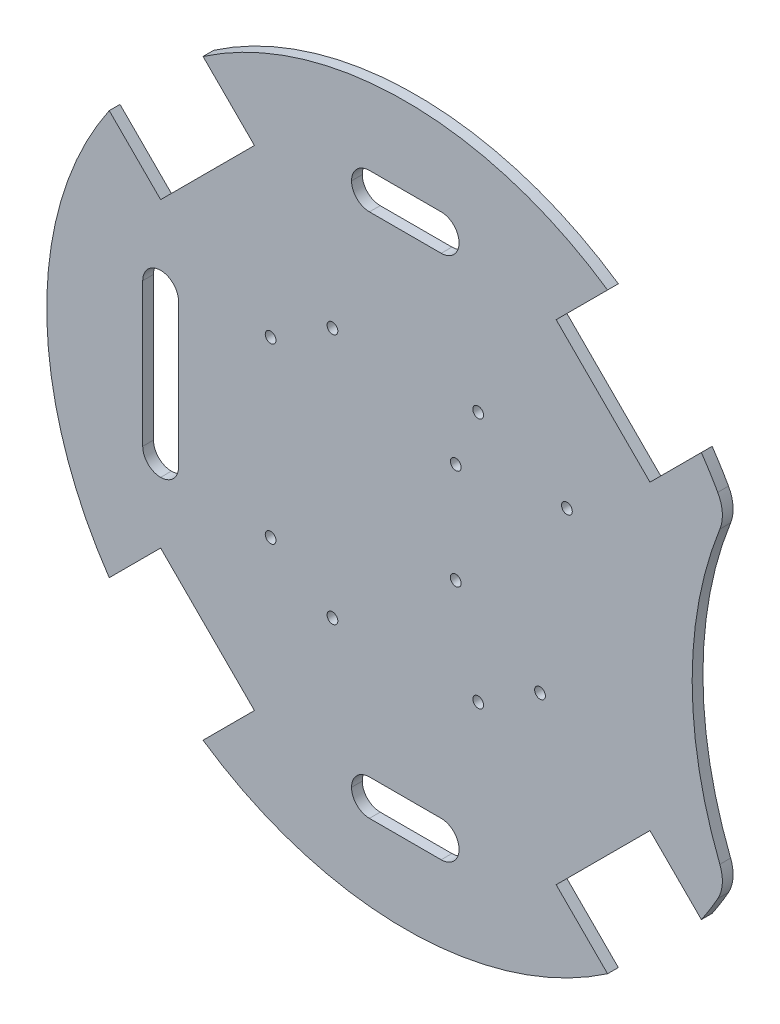
from build123d import *

# Parameters (mm, degrees)
CROQUIS1_R              = 100
SALIENTE_EXTRUIR1_DEPTH = 3
CROQUIS3_R              = 110
CORTAR_EXTRUIR1_DEPTH   = 3
REDONDEO1_R             = 10
CORTAR_EXTRUIR2_DEPTH   = 142.453172607
CROQUIS6_W              = 10
CROQUIS6_H              = 50
CROQUIS6_W_2            = 30
CROQUIS6_H_2            = 10
CORTAR_EXTRUIR4_DEPTH   = 10
REDONDEO3_R             = 5
CROQUIS7_R              = 1.5
CORTAR_EXTRUIR5_DEPTH   = 142.453172607
CROQUIS8_R              = 1.5
CORTAR_EXTRUIR6_DEPTH   = 142.453172607


with BuildPart() as part:
    # Croquis1 → Saliente-Extruir1 (new body)
    with BuildSketch(Plane.XY):
        Circle(CROQUIS1_R)
    extrude(amount=SALIENTE_EXTRUIR1_DEPTH)

    # Croquis3 → Cortar-Extruir1 (cut)
    with BuildSketch(Plane.XY.offset(3)):
        with Locations((190, 0)):
            Circle(CROQUIS3_R)
    extrude(amount=-CORTAR_EXTRUIR1_DEPTH, mode=Mode.SUBTRACT)

    # Redondeo1
    redondeo1_edges = [part.edges().sort_by_distance(p)[0] for p in [
        (89.473684211, -44.659375654, 1.5),
        (89.473684211, 44.659375654, 1.5),
    ]]
    fillet(redondeo1_edges, radius=REDONDEO1_R)

    # Croquis4 → Cortar-Extruir2 (cut, through all)
    with BuildSketch(Plane.XY.offset(3)):
        Polygon((-57.629202667, -83.792153571), (-83.792153571, -57.629202667), (-68.235804385, -42.072853481), (-42.072853481, -68.235804385), align=None)
        Polygon((-57.629202667, 83.792153571), (-42.072853481, 68.235804385), (-68.235804385, 42.072853481), (-83.792153571, 57.629202667), align=None)
        Polygon((83.792153571, 57.629202667), (68.235804385, 42.072853481), (42.072853481, 68.235804385), (57.629202667, 83.792153571), align=None)
        Polygon((57.629202667, -83.792153571), (42.072853481, -68.235804385), (68.235804385, -42.072853481), (83.792153571, -57.629202667), align=None)
    extrude(amount=-CORTAR_EXTRUIR2_DEPTH, mode=Mode.SUBTRACT)

    # Croquis6 → Cortar-Extruir4 (cut)
    with BuildSketch(Plane.XY.offset(3)):
        with Locations((-68.235804385, 0)):
            Rectangle(CROQUIS6_W, CROQUIS6_H)
        with Locations((0, 73.24)):
            Rectangle(CROQUIS6_W_2, CROQUIS6_H_2)
        with Locations((0, -73.24)):
            Rectangle(CROQUIS6_W_2, CROQUIS6_H_2)
    extrude(amount=-CORTAR_EXTRUIR4_DEPTH, mode=Mode.SUBTRACT)

    # Redondeo3
    redondeo3_edges = [part.edges().sort_by_distance(p)[0] for p in [
        (15, -78.24, 1.5),
        (-15, -78.24, 1.5),
        (15, -68.24, 1.5),
        (-15, -68.24, 1.5),
        (-73.235804385, -25, 1.5),
        (-63.235804385, -25, 1.5),
        (-73.235804385, 25, 1.5),
        (-63.235804385, 25, 1.5),
        (-15, 68.24, 1.5),
        (15, 68.24, 1.5),
        (-15, 78.24, 1.5),
        (15, 78.24, 1.5),
    ]]
    fillet(redondeo3_edges, radius=REDONDEO3_R - 0.0001)  # a hair under: the kernel refuses the full size

    # Croquis7 → Cortar-Extruir5 (cut, through all)
    with BuildSketch(Plane(origin=(0, 0, 0), x_dir=(-1, 0, 0), z_dir=(0, 0, -1))):
        with Locations((37.565, -24.17)):
            Circle(CROQUIS7_R)
        with Locations((-37.565, -24.17)):
            Circle(CROQUIS7_R)
        with Locations((-45.065, 24.17)):
            Circle(CROQUIS7_R)
        with Locations((37.565, 24.17)):
            Circle(CROQUIS7_R)
        with Locations((-14.06559482, 19.297497716)):
            Circle(CROQUIS7_R)
        with Locations((-14.061195262, -8.714642909)):
            Circle(CROQUIS7_R)
    extrude(amount=-CORTAR_EXTRUIR5_DEPTH, mode=Mode.SUBTRACT)

    # Croquis8 → Cortar-Extruir6 (cut, through all)
    with BuildSketch(Plane(origin=(0, 0, 0), x_dir=(-1, 0, 0), z_dir=(0, 0, -1))):
        with Locations((-20.32, 35)):
            Circle(CROQUIS8_R)
        with Locations((20.32, 35)):
            Circle(CROQUIS8_R)
        with Locations(Location((20.32, -35, 0), (0, 0, 180))):
            Circle(CROQUIS8_R)
        with Locations(Location((-20.32, -35, 0), (0, 0, 180))):
            Circle(CROQUIS8_R)
    extrude(amount=-CORTAR_EXTRUIR6_DEPTH, mode=Mode.SUBTRACT)


solid = part.part
